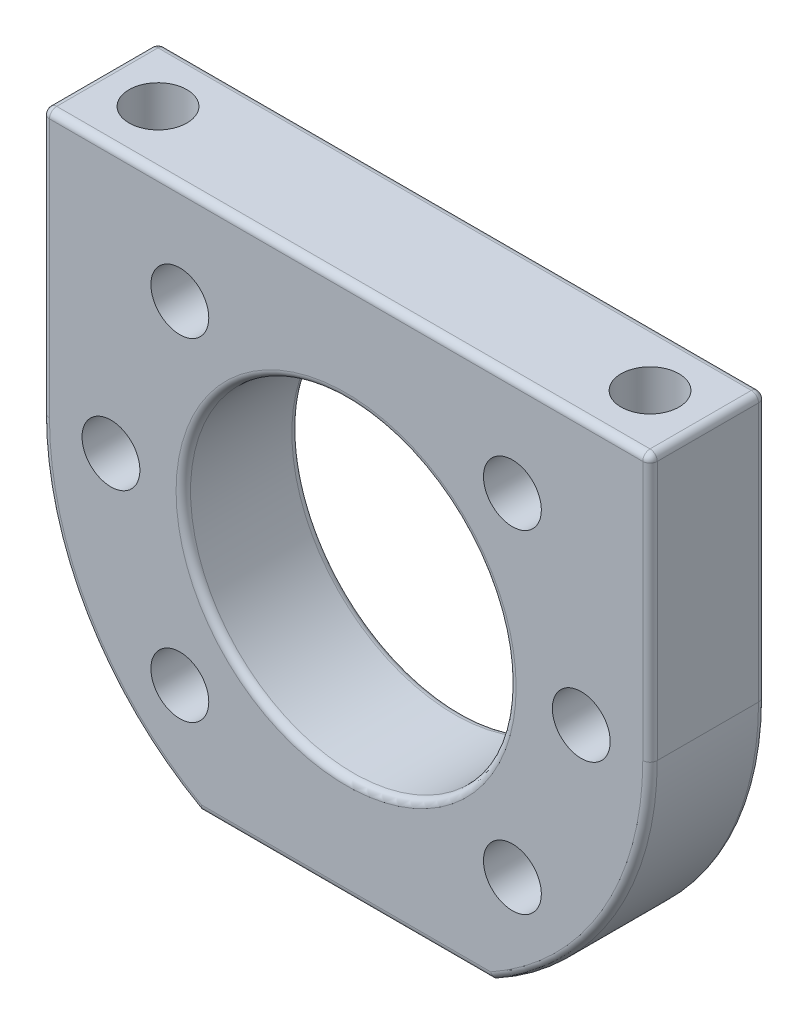
from build123d import *

# Parameters (mm, degrees)
BOSS_EXTRUDE1_DEPTH = 4
SKETCH2_R           = 11.25
CUT_EXTRUDE1_DEPTH  = 30.044104393
SKETCH3_R           = 2
CUT_EXTRUDE2_DEPTH  = 8
SKETCH6_R           = 2
CUT_EXTRUDE3_DEPTH  = 8
FILLET1_R           = 0.5


with BuildPart() as part:
    # Sketch1 → Boss-Extrude1 (new, symmetric)
    with BuildSketch(Plane.XY):
        with BuildLine():
            Line((21, 0), (21, 18.4))
            Line((21, 18.4), (-21, 18.4))
            Line((-21, 18.4), (-21, 0))
            ThreePointArc((-21, 0), (-18.076871405, -10.687690125), (-10.121264743, -18.4))
            Line((-10.121264743, -18.4), (10.121264743, -18.4))
            ThreePointArc((10.121264743, -18.4), (18.076871405, -10.687690125), (21, 0))
        make_face()
    extrude(amount=BOSS_EXTRUDE1_DEPTH, both=True)

    # Sketch2 → Cut-Extrude1 (cut, through all)
    with BuildSketch(Plane.XY.offset(4)):
        Circle(SKETCH2_R)
    extrude(amount=-CUT_EXTRUDE1_DEPTH, mode=Mode.SUBTRACT)

    # Sketch3 → Cut-Extrude2 (cut)
    with BuildSketch(Plane.XY.offset(4)):
        with Locations((-16.25, 0)):
            Circle(SKETCH3_R)
        with Locations((16.25, 0)):
            Circle(SKETCH3_R)
        with Locations((-11.490485194, 11.490485194)):
            Circle(SKETCH3_R)
        with Locations((11.490485194, 11.490485194)):
            Circle(SKETCH3_R)
        with Locations((11.490485194, -11.490485194)):
            Circle(SKETCH3_R)
        with Locations((-11.490485194, -11.490485194)):
            Circle(SKETCH3_R)
    extrude(amount=-CUT_EXTRUDE2_DEPTH, mode=Mode.SUBTRACT)

    # Sketch6 → Cut-Extrude3 (cut)
    with BuildSketch(Plane(origin=(-3.375, 18.4, 0), x_dir=(0, 0, -1), z_dir=(0, -1, 0))):
        with Locations((0, -13.625)):
            Circle(SKETCH6_R)
        with Locations((0, 20.375)):
            Circle(SKETCH6_R)
    extrude(amount=CUT_EXTRUDE3_DEPTH, mode=Mode.SUBTRACT)

    # Fillet1
    fillet1_edges = [part.edges().sort_by_distance(p)[0] for p in [
        (0, -18.4, -4),
        (0, -18.4, 4),
        (-21, 9.2, 4),
        (-11.25, 0, 4),
        (-21, 18.4, 0),
        (0, 18.4, -4),
        (0, 18.4, 4),
        (-11.25, 0, -4),
        (-21, 9.2, -4),
        (-18.076871405, -10.687690125, -4),
        (-18.076871405, -10.687690125, 4),
        (18.076871405, -10.687690125, -4),
        (21, 18.4, 0),
        (21, 9.2, -4),
        (18.076871405, -10.687690125, 4),
        (21, 9.2, 4),
    ]]
    fillet(fillet1_edges, radius=FILLET1_R)


solid = part.part
